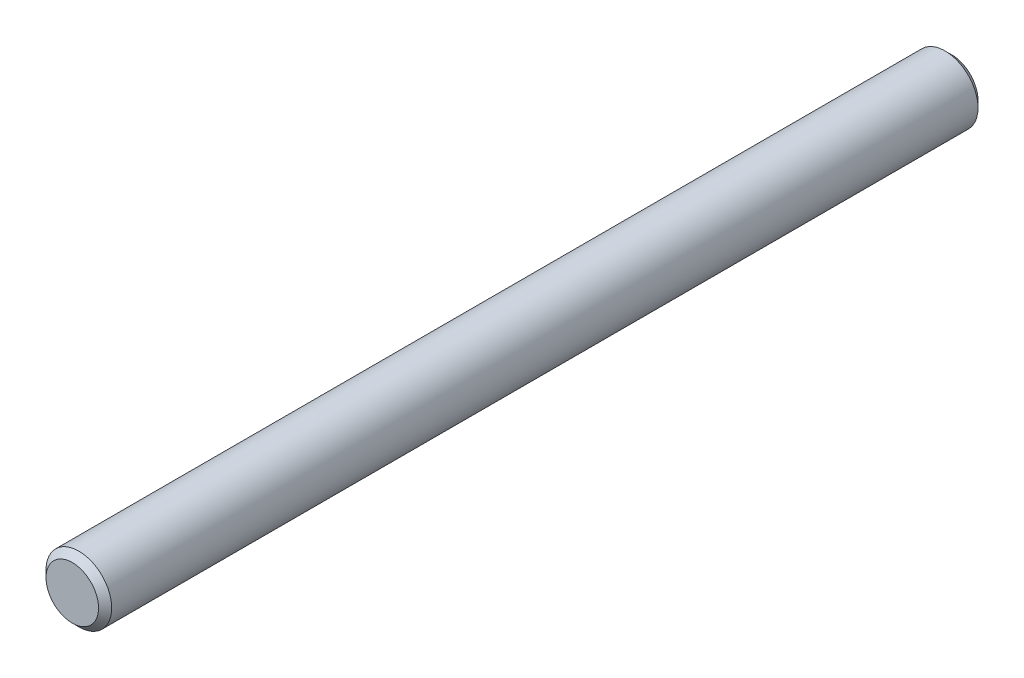
from build123d import *

# Parameters (mm, degrees)
SKETCH1_R      = 6.35
EXTRUDE1_DEPTH = 85
CHAMFER1_SIZE  = 1.27


with BuildPart() as part:
    # Sketch1 → Extrude1 (new, symmetric)
    with BuildSketch(Plane.XY):
        Circle(SKETCH1_R)
    extrude(amount=EXTRUDE1_DEPTH, both=True)

    # Chamfer1
    chamfer1_edges = [part.edges().sort_by_distance(p)[0] for p in [
        (-6.35, 0, -85),
        (-6.35, 0, 85),
    ]]
    chamfer(chamfer1_edges, length=CHAMFER1_SIZE)


solid = part.part
